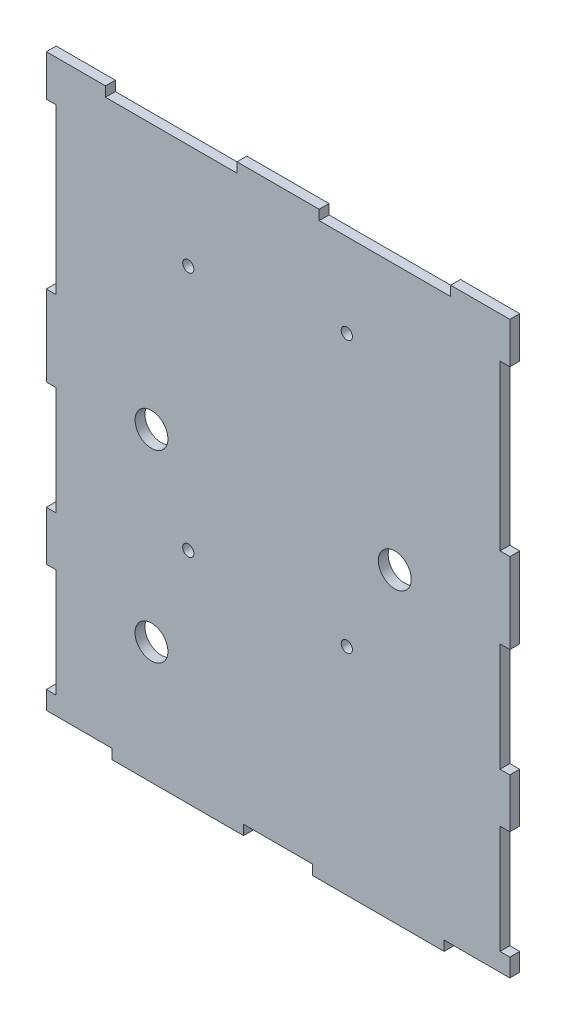
from build123d import *

# Parameters (mm, degrees)
ESQUISSE1_W                     = 141
ESQUISSE1_H                     = 173.5
BOSS_EXTRU_1_DEPTH              = 3
EMPREINTE1_START                = -93.562592566
EMPREINTE1_OUTLINE_W            = 3
EMPREINTE1_OUTLINE_H            = 3
EMPREINTE1_DEPTH                = 40
EMPREINTE1_START_2              = -28.562592566
EMPREINTE1_2_OUTLINE_W          = 3
EMPREINTE1_2_OUTLINE_H          = 3
EMPREINTE1_2_DEPTH              = 40
ESQUISSE2_W                     = 40
ESQUISSE2_H                     = 3
BOSS_EXTRU_2_DEPTH              = 3
EMPREINTE2_START                = -62.5
EMPREINTE2_OUTLINE_W            = 3
EMPREINTE2_OUTLINE_H            = 3
EMPREINTE2_DEPTH                = 50
EMPREINTE2_START_2              = -168
EMPREINTE2_2_OUTLINE_W          = 3
EMPREINTE2_2_OUTLINE_H          = 3
EMPREINTE2_2_DEPTH              = 33
EMPREINTE2_START_3              = -120
EMPREINTE2_3_OUTLINE_W          = 3
EMPREINTE2_3_OUTLINE_H          = 3
EMPREINTE2_3_DEPTH              = 33
D_GAGEMENT_M31_D                = 3.4
DIAM_TRE_DU_PER_AGE_10_0_10_1_D = 10


# Read off the part's stored shape, not the designer's step: Empreinte1, Empreinte2
with BuildPart() as part:
    # Esquisse1 → Boss.-Extru.1 (new body)
    with BuildSketch(Plane.XY):
        with Locations((-41.062592566, -86.75)):
            Rectangle(ESQUISSE1_W, ESQUISSE1_H)
    extrude(amount=BOSS_EXTRU_1_DEPTH)

    # Empreinte1 outline → Empreinte1 (cut)
    with BuildSketch(Plane.YZ.offset(EMPREINTE1_START)):
        with Locations((-1.5, 1.5)):
            Rectangle(EMPREINTE1_OUTLINE_W, EMPREINTE1_OUTLINE_H)
    extrude(amount=EMPREINTE1_DEPTH, mode=Mode.SUBTRACT)

    # Empreinte1 2 outline → Empreinte1 2 (cut)
    with BuildSketch(Plane.YZ.offset(EMPREINTE1_START_2)):
        with Locations((-1.5, 1.5)):
            Rectangle(EMPREINTE1_2_OUTLINE_W, EMPREINTE1_2_OUTLINE_H)
    extrude(amount=EMPREINTE1_2_DEPTH, mode=Mode.SUBTRACT)

    # Esquisse2 → Boss.-Extru.2 (add)
    with BuildSketch(Plane.XZ.offset(173.5)):
        with Locations((-10.562592566, 1.5)):
            Rectangle(ESQUISSE2_W, ESQUISSE2_H)
        with Locations((-71.562592566, 1.5)):
            Rectangle(ESQUISSE2_W, ESQUISSE2_H)
    extrude(amount=BOSS_EXTRU_2_DEPTH)

    # Empreinte2 outline → Empreinte2 (cut)
    with BuildSketch(Plane(origin=(0, 0, 0), x_dir=(1, 0, 0), z_dir=(0, 1, 0)).offset(EMPREINTE2_START)):
        with Locations((27.937407434, -1.5)):
            Rectangle(EMPREINTE2_OUTLINE_W, EMPREINTE2_OUTLINE_H)
        with Locations((-110.062592566, -1.5)):
            Rectangle(EMPREINTE2_OUTLINE_W, EMPREINTE2_OUTLINE_H)
    extrude(amount=EMPREINTE2_DEPTH, mode=Mode.SUBTRACT)

    # Empreinte2 2 outline → Empreinte2 2 (cut)
    with BuildSketch(Plane(origin=(0, 0, 0), x_dir=(1, 0, 0), z_dir=(0, 1, 0)).offset(EMPREINTE2_START_2)):
        with Locations((27.937407434, -1.5)):
            Rectangle(EMPREINTE2_2_OUTLINE_W, EMPREINTE2_2_OUTLINE_H)
        with Locations((-110.062592566, -1.5)):
            Rectangle(EMPREINTE2_2_OUTLINE_W, EMPREINTE2_2_OUTLINE_H)
    extrude(amount=EMPREINTE2_2_DEPTH, mode=Mode.SUBTRACT)

    # Empreinte2 3 outline → Empreinte2 3 (cut)
    with BuildSketch(Plane(origin=(0, 0, 0), x_dir=(1, 0, 0), z_dir=(0, 1, 0)).offset(EMPREINTE2_START_3)):
        with Locations((27.937407434, -1.5)):
            Rectangle(EMPREINTE2_3_OUTLINE_W, EMPREINTE2_3_OUTLINE_H)
        with Locations((-110.062592566, -1.5)):
            Rectangle(EMPREINTE2_3_OUTLINE_W, EMPREINTE2_3_OUTLINE_H)
    extrude(amount=EMPREINTE2_3_DEPTH, mode=Mode.SUBTRACT)

    # Dégagement M31 (through all)
    with Locations(Plane.XY.offset(3)):
        with Locations((-68.372592566, -34.88), (-20.152592566, -28.52), (-68.372592566, -109.76), (-20.152592566, -110.99)):
            Hole(D_GAGEMENT_M31_D / 2)

    # Diamètre du perçage Ø10.0 (10)1 (through all)
    with Locations(Plane(origin=(0, 0, 0), x_dir=(-1, 0, 0), z_dir=(0, 0, -1))):
        with Locations((79.562592566, -139.5), (79.562592566, -83.5), (5.562592566, -83.5)):
            Hole(DIAM_TRE_DU_PER_AGE_10_0_10_1_D / 2)


solid = part.part
